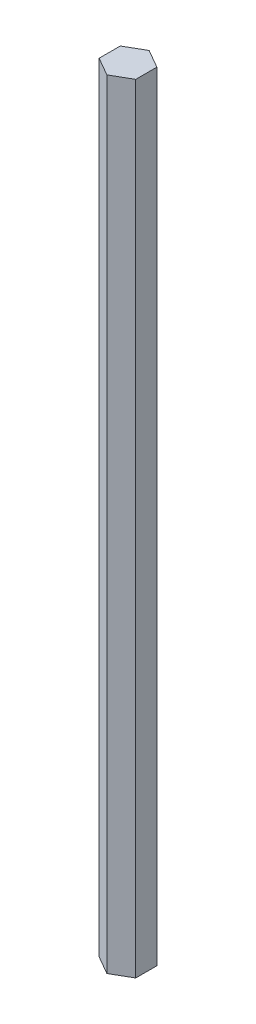
from build123d import *

# Parameters (mm, degrees)
BOSS_EXTRUDE1_DEPTH = 135


with BuildPart() as part:
    # Sketch1 → Boss-Extrude1 (new, symmetric)
    with BuildSketch(Plane(origin=(0, 0, 0), x_dir=(1, 0, 0), z_dir=(0, 1, 0))):
        Polygon((6.349472256, -3.667088137), (6.350527612, 3.665260206), (0.001055356, 7.332348343), (-6.349472256, 3.667088137), (-6.350527612, -3.665260206), (-0.001055356, -7.332348343), align=None)
    extrude(amount=BOSS_EXTRUDE1_DEPTH, both=True)


solid = part.part
